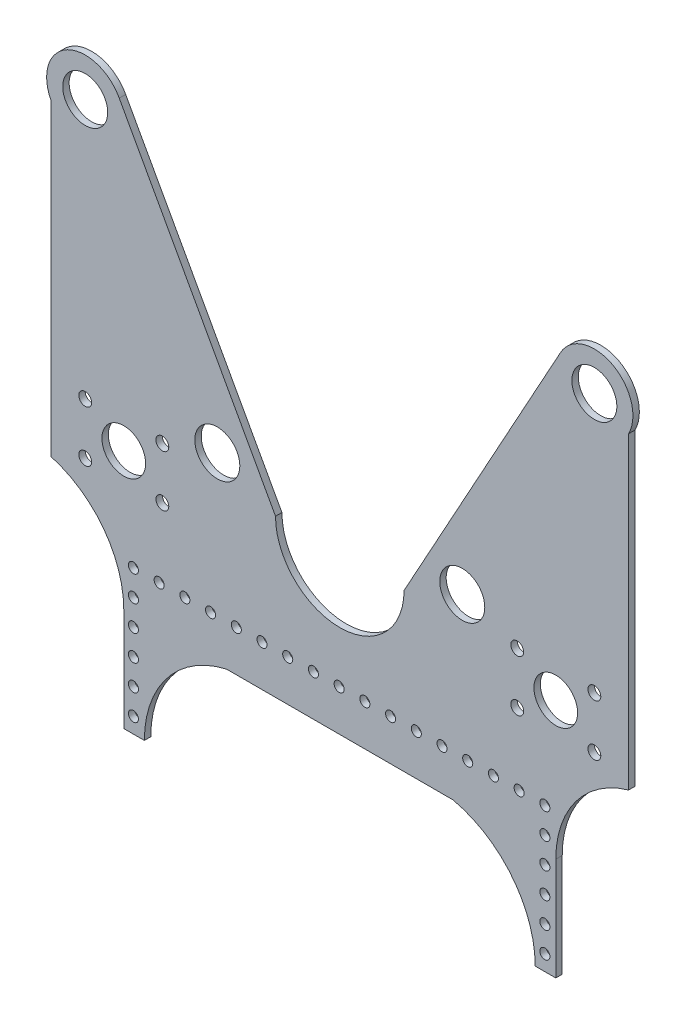
from build123d import *

# Parameters (mm, degrees)
SKETCH2_R           = 2.4892
SKETCH2_R_2         = 3.175
SKETCH2_R_3         = 10.795
SKETCH2_R_4         = 11.1125
BOSS_EXTRUDE1_DEPTH = 3.175


with BuildPart() as part:
    # Sketch2 → Boss-Extrude1 (new body)
    with BuildSketch(Plane.XY):
        with BuildLine():
            Line((142.632381685, -29.937060043), (142.632381685, 122.462939957))
            ThreePointArc((142.632381685, 122.462939957), (134.600001748, 148.101160684), (108.918256202, 140.209048468))
            Line((108.918256202, 140.209048468), (31.75, 0))
            ThreePointArc((31.75, 0), (0, -31.75), (-31.75, 0))
            Line((-31.75, 0), (-108.918256202, 140.209048469))
            ThreePointArc((-108.918256202, 140.209048469), (-134.600001748, 148.101160684), (-142.632381685, 122.462939957))
            Line((-142.632381685, 122.462939957), (-142.632381685, -29.937060043))
            ThreePointArc((-142.632381685, -29.937060043), (-116.6794163, -47.687448689), (-106.68, -77.497587619))
            Line((-106.68, -77.497587619), (-106.68, -128.297587619))
            Line((-106.68, -128.297587619), (-96.52, -128.297587619))
            ThreePointArc((-96.52, -128.297587619), (-85.109838908, -95.769716492), (-55.88, -77.497587619))
            Line((-55.88, -77.497587619), (55.88, -77.497587619))
            ThreePointArc((55.88, -77.497587619), (85.109838908, -95.769716492), (96.52, -128.297587619))
            Line((96.52, -128.297587619), (106.68, -128.297587619))
            Line((106.68, -128.297587619), (106.68, -77.497587619))
            ThreePointArc((106.68, -77.497587619), (116.6794163, -47.687448689), (142.632381685, -29.937060043))
        make_face()
        with Locations((-101.9175, -120.65)):
            Circle(SKETCH2_R, mode=Mode.SUBTRACT)
        with Locations((-101.9175, -107.95)):
            Circle(SKETCH2_R, mode=Mode.SUBTRACT)
        with Locations((-101.9175, -95.25)):
            Circle(SKETCH2_R, mode=Mode.SUBTRACT)
        with Locations((-101.9175, -82.55)):
            Circle(SKETCH2_R, mode=Mode.SUBTRACT)
        with Locations((-101.9175, -69.85)):
            Circle(SKETCH2_R, mode=Mode.SUBTRACT)
        with Locations((-101.9175, -57.15)):
            Circle(SKETCH2_R, mode=Mode.SUBTRACT)
        with Locations((-89.2175, -57.15)):
            Circle(SKETCH2_R, mode=Mode.SUBTRACT)
        with Locations((-76.5175, -57.15)):
            Circle(SKETCH2_R, mode=Mode.SUBTRACT)
        with Locations((-125.73, -22.225)):
            Circle(SKETCH2_R_2, mode=Mode.SUBTRACT)
        with Locations((-125.73, 3.175)):
            Circle(SKETCH2_R_2, mode=Mode.SUBTRACT)
        with Locations((-106.68, -9.525)):
            Circle(SKETCH2_R_3, mode=Mode.SUBTRACT)
        with Locations((-87.63, -22.225)):
            Circle(SKETCH2_R_2, mode=Mode.SUBTRACT)
        with Locations((-87.63, 3.175)):
            Circle(SKETCH2_R_2, mode=Mode.SUBTRACT)
        with Locations((-63.8175, -57.15)):
            Circle(SKETCH2_R, mode=Mode.SUBTRACT)
        with Locations((-51.1175, -57.15)):
            Circle(SKETCH2_R, mode=Mode.SUBTRACT)
        with Locations((-38.4175, -57.15)):
            Circle(SKETCH2_R, mode=Mode.SUBTRACT)
        with Locations((-25.7175, -57.15)):
            Circle(SKETCH2_R, mode=Mode.SUBTRACT)
        with Locations((-13.0175, -57.15)):
            Circle(SKETCH2_R, mode=Mode.SUBTRACT)
        with Locations((-0.3175, -57.15)):
            Circle(SKETCH2_R, mode=Mode.SUBTRACT)
        with Locations((101.2825, -120.65)):
            Circle(SKETCH2_R, mode=Mode.SUBTRACT)
        with Locations((101.2825, -107.95)):
            Circle(SKETCH2_R, mode=Mode.SUBTRACT)
        with Locations((101.2825, -95.25)):
            Circle(SKETCH2_R, mode=Mode.SUBTRACT)
        with Locations((101.2825, -82.55)):
            Circle(SKETCH2_R, mode=Mode.SUBTRACT)
        with Locations((101.2825, -69.85)):
            Circle(SKETCH2_R, mode=Mode.SUBTRACT)
        with Locations((12.3825, -57.15)):
            Circle(SKETCH2_R, mode=Mode.SUBTRACT)
        with Locations((25.0825, -57.15)):
            Circle(SKETCH2_R, mode=Mode.SUBTRACT)
        with Locations((37.7825, -57.15)):
            Circle(SKETCH2_R, mode=Mode.SUBTRACT)
        with Locations((50.4825, -57.15)):
            Circle(SKETCH2_R, mode=Mode.SUBTRACT)
        with Locations((63.1825, -57.15)):
            Circle(SKETCH2_R, mode=Mode.SUBTRACT)
        with Locations((75.8825, -57.15)):
            Circle(SKETCH2_R, mode=Mode.SUBTRACT)
        with Locations((88.5825, -57.15)):
            Circle(SKETCH2_R, mode=Mode.SUBTRACT)
        with Locations((101.2825, -57.15)):
            Circle(SKETCH2_R, mode=Mode.SUBTRACT)
        with Locations((87.63, -22.225)):
            Circle(SKETCH2_R_2, mode=Mode.SUBTRACT)
        with Locations((106.68, -9.525)):
            Circle(SKETCH2_R_3, mode=Mode.SUBTRACT)
        with Locations((87.63, 3.175)):
            Circle(SKETCH2_R_2, mode=Mode.SUBTRACT)
        with Locations((125.73, -22.225)):
            Circle(SKETCH2_R_2, mode=Mode.SUBTRACT)
        with Locations((125.73, 3.175)):
            Circle(SKETCH2_R_2, mode=Mode.SUBTRACT)
        with Locations((-60.484532313, 12.7)):
            Circle(SKETCH2_R_4, mode=Mode.SUBTRACT)
        with Locations((-125.726814921, 131.243846084)):
            Circle(SKETCH2_R_4, mode=Mode.SUBTRACT)
        with Locations((60.484532313, 12.7)):
            Circle(SKETCH2_R_4, mode=Mode.SUBTRACT)
        with Locations((125.726814921, 131.243846084)):
            Circle(SKETCH2_R_4, mode=Mode.SUBTRACT)
    extrude(amount=BOSS_EXTRUDE1_DEPTH)


solid = part.part
